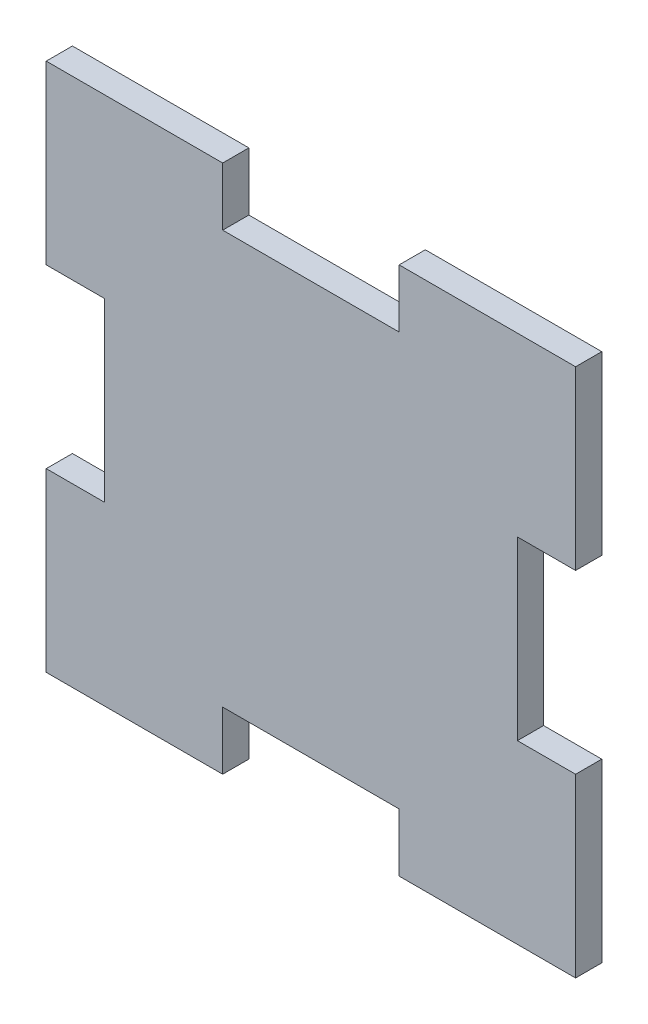
from build123d import *

# Parameters (mm, degrees)
BOSS_EXTRUDE1_DEPTH = 4.5
SKETCH2_W           = 10
SKETCH2_H           = 30.333333334
SKETCH2_W_2         = 30.333333333
SKETCH2_H_2         = 10
CUT_EXTRUDE1_DEPTH  = 132.204413177


with BuildPart() as part:
    # Sketch1 → Boss-Extrude1 (new body)
    with BuildSketch(Plane.XY):
        Polygon((1.120381921, 63.397647161), (1.120381921, 32.237647161), (1.120381921, 2.317647161), (31.040381921, 2.317647161), (62.200381921, 2.317647161), (92.120381921, 2.317647161), (92.120381921, 32.237647161), (92.120381921, 62.157647161), (92.120381921, 93.317647161), (60.960381921, 93.317647161), (31.040381921, 93.317647161), (1.120381921, 93.317647161), align=None)
    extrude(amount=BOSS_EXTRUDE1_DEPTH)

    # Sketch2 → Cut-Extrude1 (cut, through all)
    with BuildSketch(Plane.XY.offset(4.5)):
        with Locations((6.120381921, 47.817647161)):
            Rectangle(SKETCH2_W, SKETCH2_H)
        with Locations((87.120381921, 47.817647161)):
            Rectangle(SKETCH2_W, SKETCH2_H)
        with Locations((46.620381922, 88.317647161)):
            Rectangle(SKETCH2_W_2, SKETCH2_H_2)
        with Locations((46.620381922, 7.317647161)):
            Rectangle(SKETCH2_W_2, SKETCH2_H_2)
    extrude(amount=-CUT_EXTRUDE1_DEPTH, mode=Mode.SUBTRACT)


solid = part.part
